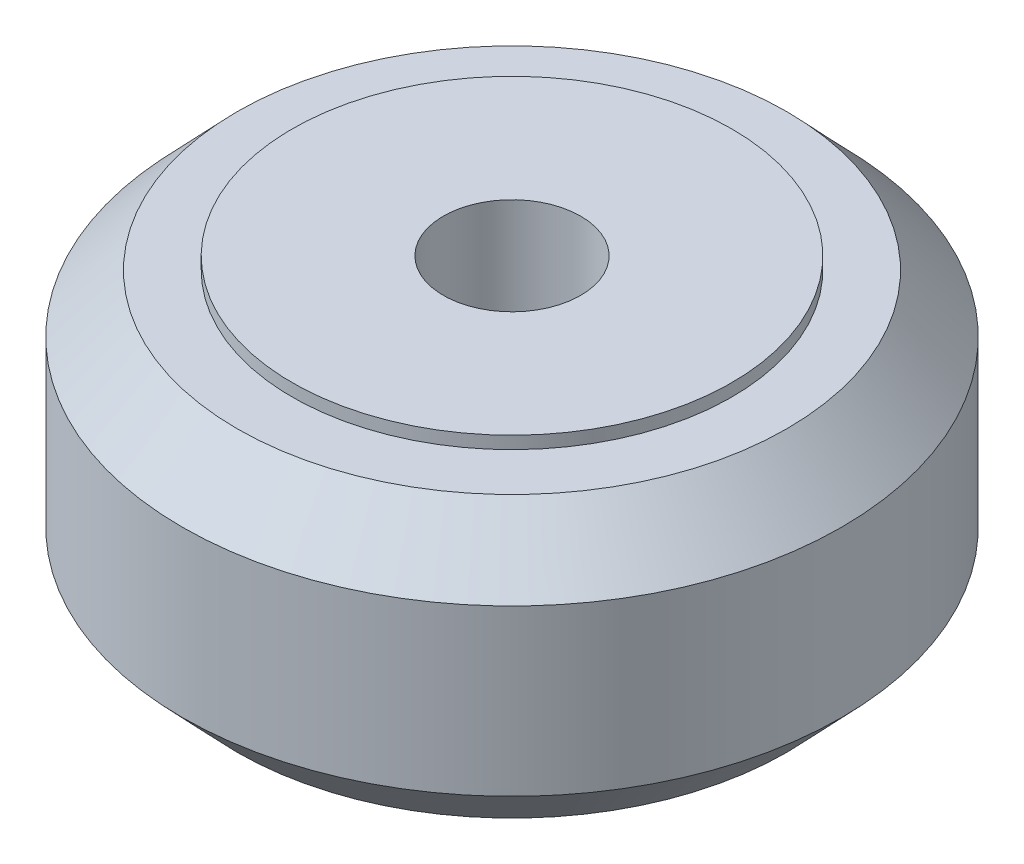
from build123d import *


with BuildPart() as part:
    # Sketch1 → Revolve1 (revolve)
    with BuildSketch(Plane.XY):
        Polygon((2.5, -5.555), (2.5, 5.555), (8, 5.555), (8, 5.1), (10, 5.1), (12, 3), (12, -3), (10, -5.1), (8, -5.1), (8, -5.555), align=None)
    revolve(axis=Axis((0, -55, 0), (0, 1, 0)))


solid = part.part
